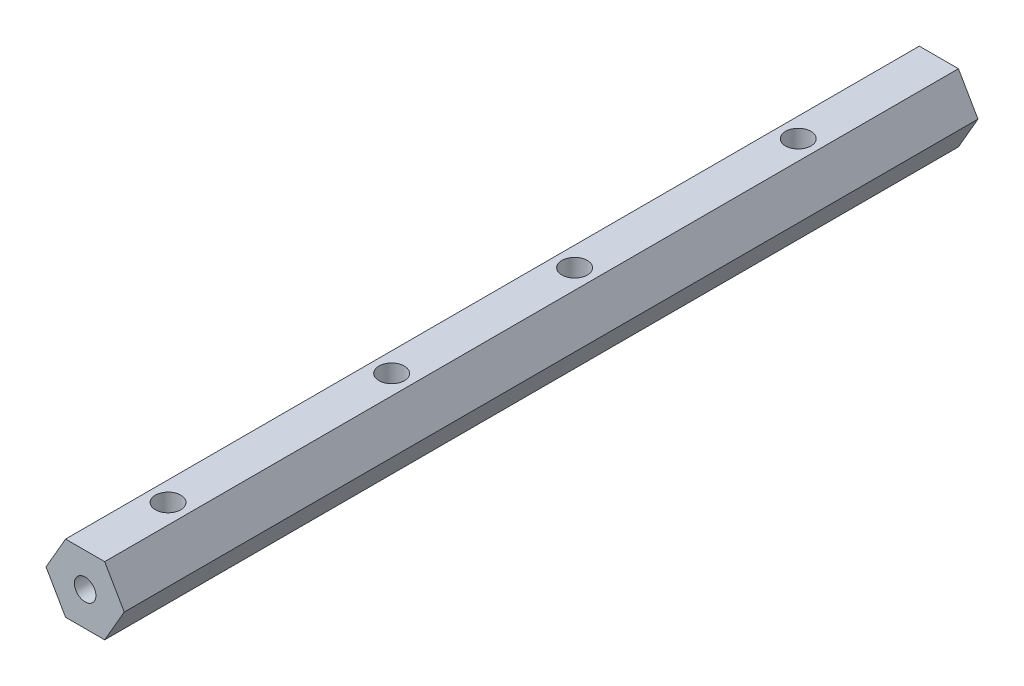
from build123d import *

# Parameters (mm, degrees)
BOSS_EXTRUDE1_DEPTH        = 160.02
F_10_32_TAPPED_HOLE1_D     = 4.0386
F_10_32_TAPPED_HOLE1_DEPTH = 76.2
F_10_32_TAPPED_HOLE1_TIP   = 1.213317848
CUT_EXTRUDE1_DEPTH         = 161.69055272
CUT_EXTRUDE1_DEPTH_BACK    = 161.69055272
SKETCH5_R                  = 2.38125


with BuildPart() as part:
    # Sketch1 → Boss-Extrude1 (new body)
    with BuildSketch(Plane.XY):
        Polygon((7.332348419, 0), (3.666174209, 6.35), (-3.666174209, 6.35), (-7.332348419, 0), (-3.666174209, -6.35), (3.666174209, -6.35), align=None)
    extrude(amount=BOSS_EXTRUDE1_DEPTH)

    # #10-32 Tapped Hole1
    with Locations(Plane.XY.offset(160.02)):
        with Locations((0, 0)):
            Hole(F_10_32_TAPPED_HOLE1_D / 2, depth=F_10_32_TAPPED_HOLE1_DEPTH)
            with Locations((0, 0, -(F_10_32_TAPPED_HOLE1_DEPTH + F_10_32_TAPPED_HOLE1_TIP / 2))):  # 118° drill point
                Cone(0, F_10_32_TAPPED_HOLE1_D / 2, F_10_32_TAPPED_HOLE1_TIP, mode=Mode.SUBTRACT)

    # Sketch5 → Cut-Extrude1 (cut, two sides: drawn at the far end of the back side and taken through both)
    with BuildSketch(Plane(origin=(0, 6.35, 0), x_dir=(1, 0, 0), z_dir=(0, 1, 0)).offset(-CUT_EXTRUDE1_DEPTH_BACK)):
        with Locations((0, -26.3652)):
            Circle(SKETCH5_R)
        with Locations((0, -68.2752)):
            Circle(SKETCH5_R)
        with Locations((0, -102.5652)):
            Circle(SKETCH5_R)
        with Locations((0, -144.4752)):
            Circle(SKETCH5_R)
    extrude(amount=CUT_EXTRUDE1_DEPTH + CUT_EXTRUDE1_DEPTH_BACK, mode=Mode.SUBTRACT)


solid = part.part
